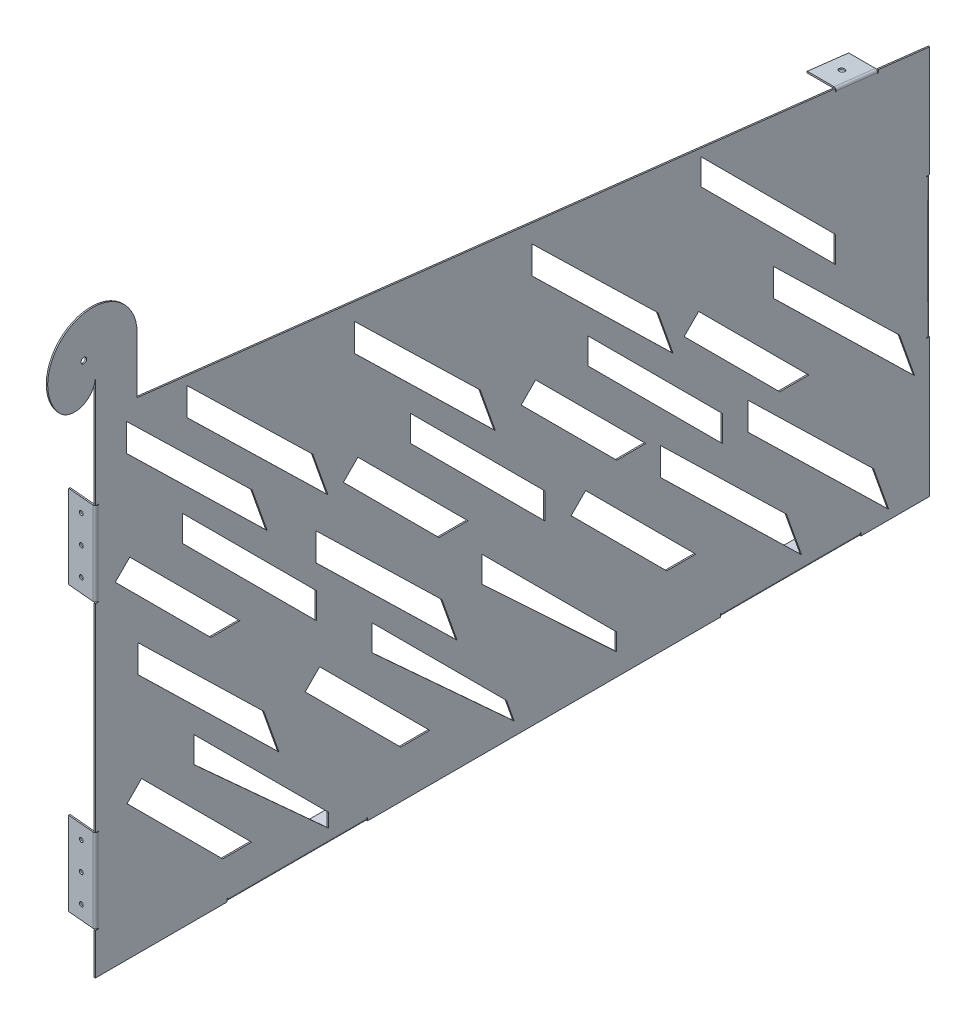
from build123d import *

# Parameters (mm, degrees)
BASE_FLANGE1_DEPTH            = 1
EDGE_FLANGE1_STRIP_W          = 5.4732
EDGE_FLANGE1_STRIP_H          = 1
EDGE_FLANGE1_STRIP_CUT_DEPTH  = 100
EDGE_FLANGE1_RELIEF_W         = 5.9732
EDGE_FLANGE1_RELIEF_H         = 0.5
EDGE_FLANGE1_RELIEF_CUT_DEPTH = 1
EDGE_FLANGE1_DEPTH            = 100
EDGE_FLANGE1_PROFILE_W        = 100
EDGE_FLANGE1_PROFILE_H        = 19.2634
EDGE_FLANGE1_PROFILE_R        = 1.5
EDGE_FLANGE1_FLAT_DEPTH       = 1
EDGE_FLANGE2_START            = -132.311951656
EDGE_FLANGE2_DEPTH            = 61
EDGE_FLANGE2_2_DEPTH          = 0.5
EDGE_FLANGE2_START_2          = -71.811951656
EDGE_FLANGE2_3_DEPTH          = 0.5
EDGE_FLANGE2_START_3          = -131.811951656
EDGE_FLANGE2_4_DEPTH          = 60
EDGE_FLANGE2_START_4          = -321.467617465
EDGE_FLANGE2_5_OUTLINE_R      = 1.5
EDGE_FLANGE2_5_DEPTH          = 1.000000001
CUT_EXTRUDE1_DEPTH            = 10
EDGE_FLANGE3_STRIP_W          = 5.4732
EDGE_FLANGE3_STRIP_H          = 1
EDGE_FLANGE3_STRIP_CUT_DEPTH  = 30
EDGE_FLANGE3_RELIEF_W         = 5.9732
EDGE_FLANGE3_RELIEF_H         = 0.5
EDGE_FLANGE3_RELIEF_CUT_DEPTH = 1
EDGE_FLANGE3_DEPTH            = 30
EDGE_FLANGE3_PROFILE_W        = 30
EDGE_FLANGE3_PROFILE_H        = 19.2634
EDGE_FLANGE3_PROFILE_R        = 2
EDGE_FLANGE3_FLAT_DEPTH       = 1
EDGE_FLANGE4_START            = -62.311951656
EDGE_FLANGE4_DEPTH            = 101
EDGE_FLANGE4_2_DEPTH          = 0.5
EDGE_FLANGE4_START_2          = 38.188048344
EDGE_FLANGE4_3_DEPTH          = 0.5
EDGE_FLANGE4_START_3          = -61.811951656
EDGE_FLANGE4_4_DEPTH          = 100
EDGE_FLANGE4_START_4          = 274.467223567
EDGE_FLANGE4_5_OUTLINE_R      = 1.5
EDGE_FLANGE4_5_DEPTH          = 1
SKETCH19_R                    = 2
CUT_EXTRUDE2_DEPTH            = 10


with BuildPart() as part:
    # Base-Flange1: sheet metal written as solids
    # Sketch1 → Base-Flange1 (new body)
    with BuildSketch(Plane(origin=(0, 0, 0), x_dir=(0, 0, -1), z_dir=(1, 0, 0))):
        with BuildLine():
            Line((-292.608082875, 184.688048344), (277.391917125, 118.188048344))
            Line((277.391917125, 118.188048344), (277.391917125, -161.811951656))
            Line((277.391917125, -161.811951656), (-322.608082875, -161.811951656))
            Line((-322.608082875, -161.811951656), (-322.608082875, 188.188048344))
            Line((-322.608082875, 188.188048344), (-322.608082875, 213.188048344))
            ThreePointArc((-322.608082875, 213.188048344), (-332.239042701, 199.181856584), (-348.764537222, 203.161407511))
            ThreePointArc((-348.764537222, 203.161407511), (-336.339280516, 254.75856393), (-292.608082875, 224.688048344))
            Line((-292.608082875, 224.688048344), (-292.608082875, 184.688048344))
        make_face()
    extrude(amount=-BASE_FLANGE1_DEPTH)

    # Edge-Flange1: sheet metal written as solids
    # Edge-Flange1 strip (on a plane across the edge) → Edge-Flange1 strip cut (cut)
    with BuildSketch(Plane(origin=(-1, -161.811951656, -227.391917125), x_dir=(0, 1, 0), z_dir=(0, 0, 1))):
        with Locations((-1, -0.5)):
            Rectangle(EDGE_FLANGE1_STRIP_W, EDGE_FLANGE1_STRIP_H)
    edge_flange1_strip_cut = extrude(amount=EDGE_FLANGE1_STRIP_CUT_DEPTH, mode=Mode.SUBTRACT)

    # Edge-Flange1 relief (on the sheet) → Edge-Flange1 relief cut (cut)
    with BuildSketch(Plane(origin=(-1, -160.075351656, -227.391917125), x_dir=(0, 1, 0), z_dir=(-1, 0, 0))):
        with Locations((-2.4866, 0.25)):
            Rectangle(EDGE_FLANGE1_RELIEF_W, EDGE_FLANGE1_RELIEF_H)
        with Locations((-2.4866, -100.25)):
            Rectangle(EDGE_FLANGE1_RELIEF_W, EDGE_FLANGE1_RELIEF_H)
    edge_flange1_relief_cut = extrude(amount=-EDGE_FLANGE1_RELIEF_CUT_DEPTH, mode=Mode.SUBTRACT)

    # Edge-Flange1 bend section (on a plane across the edge) → Edge-Flange1 (add)
    with BuildSketch(Plane(origin=(-1, -161.811951656, -227.391917125), x_dir=(0, 1, 0), z_dir=(0, 0, 1))):
        with BuildLine():
            Line((0, 0.7366), (1, 0.7366))
            ThreePointArc((1, 0.7366), (1.215745145, 0.215745145), (1.7366, 0))
            Line((1.7366, 0), (1.7366, -1))
            ThreePointArc((1.7366, -1), (0.508638364, -0.491361636), (0, 0.7366))
        make_face()
    edge_flange1 = extrude(amount=EDGE_FLANGE1_DEPTH)

    # Edge-Flange1 profile (on flange) → Edge-Flange1 flat (add)
    with BuildSketch(Plane(origin=(-1, -161.811951656, 0), x_dir=(0, 0, -1), z_dir=(0, 1, 0))):
        with Locations((177.391917125, 10.3683)):
            Rectangle(EDGE_FLANGE1_PROFILE_W, EDGE_FLANGE1_PROFILE_H)
        with Locations((142.391917125, 10)):
            Circle(EDGE_FLANGE1_PROFILE_R, mode=Mode.SUBTRACT)
        with Locations((212.391917125, 10)):
            Circle(EDGE_FLANGE1_PROFILE_R, mode=Mode.SUBTRACT)
        with Locations((177.391917125, 10)):
            Circle(EDGE_FLANGE1_PROFILE_R, mode=Mode.SUBTRACT)
    edge_flange1_flat = extrude(amount=EDGE_FLANGE1_FLAT_DEPTH)

    # Mirror1: Edge-Flange1 strip cut, Edge-Flange1 relief cut, Edge-Flange1, Edge-Flange1 flat across plane
    add(edge_flange1_strip_cut.mirror(Plane.XY), mode=Mode.SUBTRACT)
    add(edge_flange1_relief_cut.mirror(Plane.XY), mode=Mode.SUBTRACT)
    add(edge_flange1.mirror(Plane.XY))
    add(edge_flange1_flat.mirror(Plane.XY))

    # Edge-Flange2: read off the stored shape, not the designer's step
    # Edge-Flange2 outline → Edge-Flange2 (cut)
    with BuildSketch(Plane(origin=(0, 0, 0), x_dir=(1, 0, 0), z_dir=(0, 1, 0)).offset(EDGE_FLANGE2_START)):
        with BuildLine():
            Line((0, -322.608082875), (0, -320.800405196))
            ThreePointArc((0, -320.800405196), (-0.271171885, -321.73223136), (-1, -322.373046287))
            Line((-1, -322.373046287), (-1, -322.608082875))
            Line((-1, -322.608082875), (0, -322.608082875))
        make_face()
    edge_flange2 = extrude(amount=EDGE_FLANGE2_DEPTH, mode=Mode.SUBTRACT)

    # Edge-Flange2 2 outline → Edge-Flange2 2 (cut)
    with BuildSketch(Plane(origin=(0, 0, 0), x_dir=(1, 0, 0), z_dir=(0, 1, 0)).offset(EDGE_FLANGE2_START)):
        with BuildLine():
            Line((0, -320.300405196), (-1, -320.300405196))
            Line((-1, -320.300405196), (-1, -322.373046287))
            ThreePointArc((-1, -322.373046287), (-0.271171885, -321.73223136), (0, -320.800405196))
            Line((0, -320.800405196), (0, -320.300405196))
        make_face()
    edge_flange2_2 = extrude(amount=EDGE_FLANGE2_2_DEPTH, mode=Mode.SUBTRACT)

    # Edge-Flange2 3 outline → Edge-Flange2 3 (cut)
    with BuildSketch(Plane(origin=(0, 0, 0), x_dir=(1, 0, 0), z_dir=(0, 1, 0)).offset(EDGE_FLANGE2_START_2)):
        with BuildLine():
            Line((0, -320.300405196), (-1, -320.300405196))
            Line((-1, -320.300405196), (-1, -322.373046287))
            ThreePointArc((-1, -322.373046287), (-0.271171885, -321.73223136), (0, -320.800405196))
            Line((0, -320.800405196), (0, -320.300405196))
        make_face()
    edge_flange2_3 = extrude(amount=EDGE_FLANGE2_3_DEPTH, mode=Mode.SUBTRACT)

    # Edge-Flange2 4 outline → Edge-Flange2 4 (add)
    with BuildSketch(Plane(origin=(0, 0, 0), x_dir=(1, 0, 0), z_dir=(0, 1, 0)).offset(EDGE_FLANGE2_START_3)):
        with BuildLine():
            Line((-1, -322.373046287), (-1, -320.800405196))
            ThreePointArc((-1, -320.800405196), (-1.238960253, -321.343483682), (-1.80079892, -321.53420221))
            Line((-1.80079892, -321.53420221), (-20.923893962, -319.861148183))
            Line((-20.923893962, -319.861148183), (-21.011049705, -320.857342881))
            Line((-21.011049705, -320.857342881), (-1.887954663, -322.530396908))
            ThreePointArc((-1.887954663, -322.530396908), (-1.433585428, -322.510364765), (-1, -322.373046287))
        make_face()
    edge_flange2_4 = extrude(amount=EDGE_FLANGE2_4_DEPTH)

    # Edge-Flange2 5 outline → Edge-Flange2 5 (cut)
    with BuildSketch(Plane(origin=(0, 0, 0), x_dir=(0.9961946980917458, 0, 0.0871557427476548), z_dir=(0.0871557427476548, 0, -0.9961946980917459)).offset(EDGE_FLANGE2_START_4)):
        with Locations((17.033463718, 121.811951656)):
            Circle(EDGE_FLANGE2_5_OUTLINE_R)
        with Locations((17.033463718, 101.811951656)):
            Circle(EDGE_FLANGE2_5_OUTLINE_R)
        with Locations((17.033463718, 81.811951656)):
            Circle(EDGE_FLANGE2_5_OUTLINE_R)
    edge_flange2_5 = extrude(amount=EDGE_FLANGE2_5_DEPTH, mode=Mode.SUBTRACT)

    # Mirror2: Edge-Flange2, Edge-Flange2 2, Edge-Flange2 3, Edge-Flange2 4, Edge-Flange2 5 across plane
    add(edge_flange2.mirror(Plane.ZX), mode=Mode.SUBTRACT)
    add(edge_flange2_2.mirror(Plane.ZX), mode=Mode.SUBTRACT)
    add(edge_flange2_3.mirror(Plane.ZX), mode=Mode.SUBTRACT)
    add(edge_flange2_4.mirror(Plane.ZX))
    add(edge_flange2_5.mirror(Plane.ZX), mode=Mode.SUBTRACT)

    # Sketch12 → Cut-Extrude1 (cut)
    with BuildSketch(Plane(origin=(0, 0, 0), x_dir=(0, 0, -1), z_dir=(1, 0, 0))):
        Polygon((83.881498856, -33.449819349), (174.342704111, -121.420431977), (185.213154513, -152.135664153), (83.881498856, -53.388999712), align=None)
        Polygon((-44.580106557, -36.904606479), (52.054055129, -133.538768165), (52.054055129, -145.866147521), (-44.580106557, -55.633624841), align=None)
        Polygon((29.921378653, -34.478937477), (109.107705591, -113.665264414), (88.243560484, -113.665264414), (19.4893061, -44.91101003), align=None)
        Polygon((-8.549939292, 138.296703352), (81.911265962, 50.326090724), (92.781716365, 19.610858548), (-8.549939292, 118.357522989), align=None)
        Polygon((31.714294744, 60.920031966), (128.34845643, -35.71412972), (128.34845643, -54.443148082), (31.714294744, 42.191013604), align=None)
        Polygon((-6.033424665, 52.424839755), (73.152902272, -26.761487182), (52.288757165, -26.761487182), (-16.465497218, 41.992767202), align=None)
        Polygon((-163.902775614, 37.300582979), (-73.441570359, -50.670029649), (-62.571119957, -81.385261826), (-163.902775614, 17.361402616), align=None)
        Polygon((-123.638541578, -40.076088407), (-27.004379892, -136.710250093), (-21.535031946, -152.267786527), (-123.638541578, -58.805106769), align=None)
        Polygon((-161.386260987, -48.571280618), (-82.19993405, -127.757607555), (-103.064079156, -127.757607555), (-171.81833354, -59.003353172), align=None)
        Polygon((-136.388882356, 154.066861683), (-45.927677102, 66.096249055), (-35.057226699, 35.381016878), (-136.388882356, 134.12768132), align=None)
        Polygon((-96.12464832, 76.690190297), (0.509513366, -19.943971389), (0.509513366, -38.672989751), (-96.12464832, 57.961171935), align=None)
        Polygon((-133.872367729, 68.194998086), (-54.686040792, -10.991328851), (-75.550185899, -10.991328851), (-144.304440282, 57.762925532), align=None)
        Polygon((-300.465636052, 173.863443417), (-210.004430798, 85.892830789), (-199.133980395, 55.177598613), (-300.465636052, 153.924263054), align=None)
        Polygon((-260.201402016, 96.486772031), (-163.56724033, -0.147389655), (-163.56724033, -18.876408017), (-260.201402016, 77.757753669), align=None)
        Polygon((-297.949121425, 87.99157982), (-218.762794488, 8.805252883), (-239.626939595, 8.805252883), (-308.381193978, 77.559507267), align=None)
        Polygon((-291.975122926, 31.699587994), (-201.513917672, -56.271024634), (-190.64346727, -86.98625681), (-291.975122926, 11.760407631), align=None)
        Polygon((-251.710888891, -45.677083392), (-155.076727205, -142.311245078), (-155.076727205, -152.267786527), (-251.710888891, -64.406101754), align=None)
        Polygon((-289.458608299, -54.172275603), (-210.272281362, -133.35860254), (-231.136426469, -133.35860254), (-299.890680853, -64.604348156), align=None)
        Polygon((165.156498308, 37.474871914), (255.617703563, -50.495740714), (266.488153965, -81.210972891), (165.156498308, 17.535691551), align=None)
        Polygon((111.196378106, 36.445753786), (190.382705043, -42.740573152), (169.518559936, -42.740573152), (100.764305552, 26.013681232), align=None)
        Polygon((112.989294196, 131.844723229), (209.623455882, 35.210561543), (209.623455882, 16.481543181), (112.989294196, 113.115704867), align=None)
        Polygon((146.547729139, -36.45763218), (237.008934394, -124.428244808), (247.879384796, -155.143476984), (146.547729139, -56.396812543), align=None)
        Polygon((-256.782869716, 174.26011882), (-166.321664461, 86.289506192), (-155.451214059, 55.574274016), (-256.782869716, 154.320938457), align=None)
    extrude(amount=-CUT_EXTRUDE1_DEPTH, mode=Mode.SUBTRACT)

    # Edge-Flange3: sheet metal written as solids
    # Edge-Flange3 strip (on a plane across the edge) → Edge-Flange3 strip cut (cut)
    with BuildSketch(Plane(origin=(-1, 126.016184071, -210.29361089), x_dir=(-3.4914813388431334e-15, -0.993263139087243, 0.11588069956017823), z_dir=(0, -0.11588069956017823, -0.993263139087243))):
        with Locations((-1, -0.5)):
            Rectangle(EDGE_FLANGE3_STRIP_W, EDGE_FLANGE3_STRIP_H)
    extrude(amount=EDGE_FLANGE3_STRIP_CUT_DEPTH, mode=Mode.SUBTRACT)

    # Edge-Flange3 relief (on the sheet) → Edge-Flange3 relief cut (cut)
    with BuildSketch(Plane(origin=(-1, 124.291283304, -210.092372467), x_dir=(-6.982962677686267e-15, -0.993263139087243, 0.11588069956017823), z_dir=(-1, 0, 0))):
        with Locations((-2.4866, 0.25)):
            Rectangle(EDGE_FLANGE3_RELIEF_W, EDGE_FLANGE3_RELIEF_H)
        with Locations((-2.4866, -30.25)):
            Rectangle(EDGE_FLANGE3_RELIEF_W, EDGE_FLANGE3_RELIEF_H)
    extrude(amount=-EDGE_FLANGE3_RELIEF_CUT_DEPTH, mode=Mode.SUBTRACT)

    # Edge-Flange3 bend section (on a plane across the edge) → Edge-Flange3 (add)
    with BuildSketch(Plane(origin=(-1, 126.016184071, -210.29361089), x_dir=(-3.4914813388431334e-15, -0.993263139087243, 0.11588069956017823), z_dir=(0, -0.11588069956017823, -0.993263139087243))):
        with BuildLine():
            Line((0, 0.7366), (1, 0.7366))
            ThreePointArc((1, 0.7366), (1.215745145, 0.215745145), (1.7366, 0))
            Line((1.7366, 0), (1.7366, -1))
            ThreePointArc((1.7366, -1), (0.508638364, -0.491361636), (0, 0.7366))
        make_face()
    extrude(amount=EDGE_FLANGE3_DEPTH)

    # Edge-Flange3 profile (on flange) → Edge-Flange3 flat (add)
    with BuildSketch(Plane(origin=(-1, 148.52879672, -17.328359617), x_dir=(0, 0.11588069956017823, 0.993263139087243), z_dir=(-3.4914813388431334e-15, -0.993263139087243, 0.11588069956017823))):
        with Locations((-209.274048516, 10.3683)):
            Rectangle(EDGE_FLANGE3_PROFILE_W, EDGE_FLANGE3_PROFILE_H)
        with Locations((-209.274048516, 10)):
            Circle(EDGE_FLANGE3_PROFILE_R, mode=Mode.SUBTRACT)
    extrude(amount=EDGE_FLANGE3_FLAT_DEPTH)

    # Edge-Flange4: read off the stored shape, not the designer's step
    # Edge-Flange4 outline → Edge-Flange4 (cut)
    with BuildSketch(Plane(origin=(0, 0, 0), x_dir=(1, 0, 0), z_dir=(0, 1, 0)).offset(EDGE_FLANGE4_START)):
        with BuildLine():
            ThreePointArc((-1, 277.301124595), (-0.271171885, 276.660309668), (0, 275.728483504))
            Line((0, 275.728483504), (0, 277.391917125))
            Line((0, 277.391917125), (-1, 277.391917125))
            Line((-1, 277.391917125), (-1, 277.301124595))
        make_face()
    extrude(amount=EDGE_FLANGE4_DEPTH, mode=Mode.SUBTRACT)

    # Edge-Flange4 2 outline → Edge-Flange4 2 (cut)
    with BuildSketch(Plane(origin=(0, 0, 0), x_dir=(1, 0, 0), z_dir=(0, 1, 0)).offset(EDGE_FLANGE4_START)):
        with BuildLine():
            Line((-1, 275.228483504), (0, 275.228483504))
            Line((0, 275.228483504), (0, 275.728483504))
            ThreePointArc((0, 275.728483504), (-0.271171885, 276.660309668), (-1, 277.301124595))
            Line((-1, 277.301124595), (-1, 275.228483504))
        make_face()
    extrude(amount=EDGE_FLANGE4_2_DEPTH, mode=Mode.SUBTRACT)

    # Edge-Flange4 3 outline → Edge-Flange4 3 (cut)
    with BuildSketch(Plane(origin=(0, 0, 0), x_dir=(1, 0, 0), z_dir=(0, 1, 0)).offset(EDGE_FLANGE4_START_2)):
        with BuildLine():
            Line((-1, 275.228483504), (0, 275.228483504))
            Line((0, 275.228483504), (0, 275.728483504))
            ThreePointArc((0, 275.728483504), (-0.271171885, 276.660309668), (-1, 277.301124595))
            Line((-1, 277.301124595), (-1, 275.228483504))
        make_face()
    extrude(amount=EDGE_FLANGE4_3_DEPTH, mode=Mode.SUBTRACT)

    # Edge-Flange4 4 outline → Edge-Flange4 4 (add)
    with BuildSketch(Plane(origin=(0, 0, 0), x_dir=(1, 0, 0), z_dir=(0, 1, 0)).offset(EDGE_FLANGE4_START_3)):
        with BuildLine():
            ThreePointArc((-1.652575872, 276.460275487), (-1.186840174, 276.218732108), (-1, 275.728483504))
            Line((-1, 275.728483504), (-1, 277.301124595))
            ThreePointArc((-1, 277.301124595), (-1.26306344, 277.399274541), (-1.538505646, 277.453748176))
            Line((-1.538505646, 277.453748176), (-20.755383553, 279.660224128))
            Line((-20.755383553, 279.660224128), (-20.869453778, 278.66675144))
            Line((-20.869453778, 278.66675144), (-1.652575872, 276.460275487))
        make_face()
    extrude(amount=EDGE_FLANGE4_4_DEPTH)

    # Edge-Flange4 5 outline → Edge-Flange4 5 (cut)
    with BuildSketch(Plane(origin=(0, 0, 0), x_dir=(0.9934726889248264, 0, 0.11407022556511005), z_dir=(0.11407022556511005, 0, -0.9934726889248264)).offset(EDGE_FLANGE4_START_4)):
        with Locations((-42.520811556, 41.811951656)):
            Circle(EDGE_FLANGE4_5_OUTLINE_R)
        with Locations((-42.520811556, 11.811951656)):
            Circle(EDGE_FLANGE4_5_OUTLINE_R)
        with Locations((-42.520811556, -18.188048344)):
            Circle(EDGE_FLANGE4_5_OUTLINE_R)
    extrude(amount=EDGE_FLANGE4_5_DEPTH, mode=Mode.SUBTRACT)

    # Sketch19 → Cut-Extrude2 (cut)
    with BuildSketch(Plane.ZY.offset(1)):
        with Locations((330.974739307, 226.919394192)):
            Circle(SKETCH19_R)
    extrude(amount=-CUT_EXTRUDE2_DEPTH, mode=Mode.SUBTRACT)


solid = part.part
